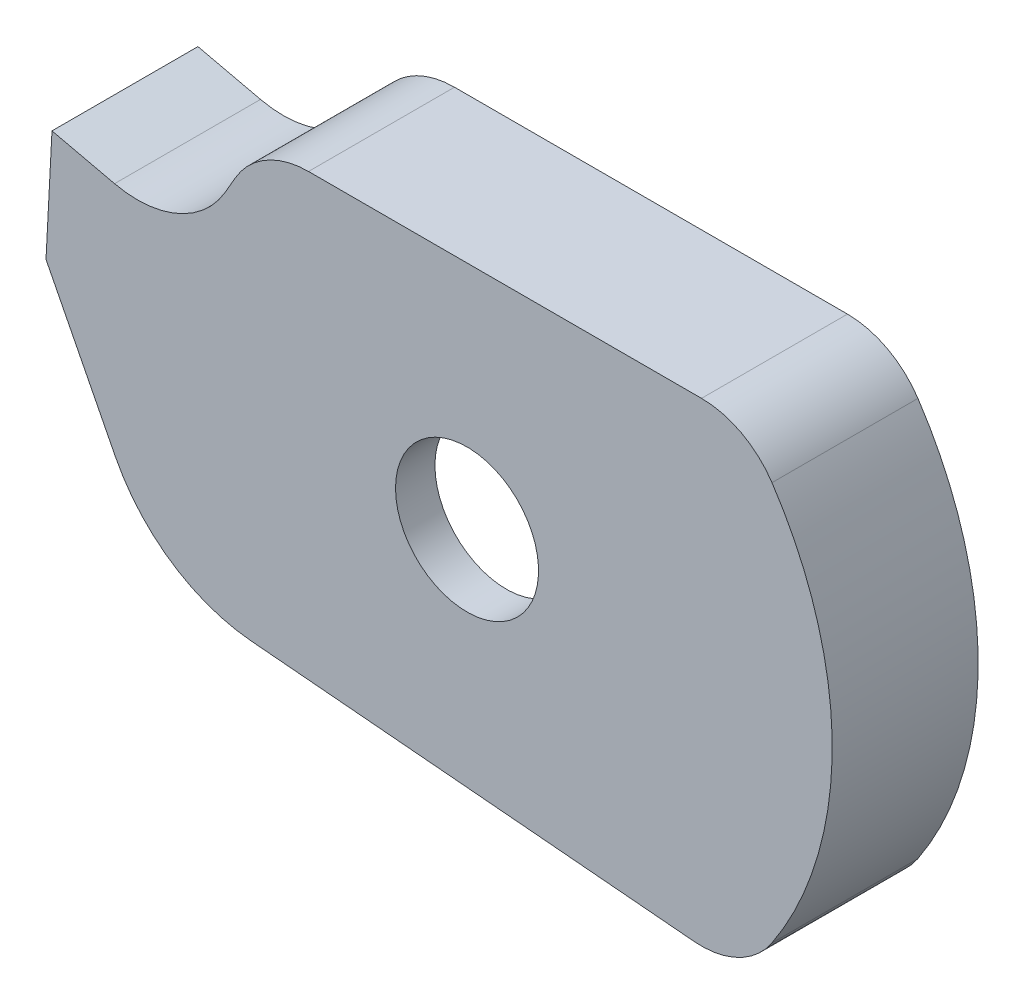
from build123d import *

# Parameters (mm, degrees)
EXTRUS_O_ESQ_DEPTH   = 50
REBAIXO_CAMISA_DEPTH = 36.5
ESBO_O2_3_R          = 24.5
FURO_EIXO_DEPTH      = 175.517212369
FILETE1_R            = 7


with BuildPart() as part:
    # Sketch2 → EXTRUSÃO ESQ (new body)
    with BuildSketch(Plane.XY):
        with BuildLine():
            Line((-122.610977602, 44.351076804), (-144.047119027, 49.3))
            Line((-144.047119027, 49.3), (-146.098883586, 10.15))
            Line((-146.098883586, 10.15), (-122.334497064, -36.490234645))
            ThreePointArc((-122.334497064, -36.490234645), (-103.089307062, -58.242964868), (-75.71115174, -67.938078149))
            Line((-75.71115174, -67.938078149), (75.873308647, -81.2))
            ThreePointArc((75.873308647, -81.2), (90.951418202, -78.45385419), (102.524156014, -68.405847219))
            ThreePointArc((102.524156014, -68.405847219), (123.249969505, -0.086700127), (102.620294615, 68.261538462))
            ThreePointArc((102.620294615, 68.261538462), (92.171338681, 77.761539619), (78.474342941, 81.2))
            Line((78.474342941, 81.2), (-56.15804675, 81.2))
            ThreePointArc((-56.15804675, 81.2), (-70.65804675, 77.31473671), (-81.27278346, 66.7))
            Line((-81.27278346, 66.7), (-84.644996859, 60.859155059))
            ThreePointArc((-84.644996859, 60.859155059), (-100.906213312, 46.34546447), (-122.610977602, 44.351076804))
        make_face()
    extrude(amount=EXTRUS_O_ESQ_DEPTH)

    # Esboço2 → REBAIXO CAMISA (cut)
    with BuildSketch(Plane(origin=(0, 0, 0), x_dir=(-1, 0, 0), z_dir=(0, 0, -1))):
        with BuildLine():
            Line((-47.203483412, 58.071858667), (40.46165002, 65.741564029))
            ThreePointArc((40.46165002, 65.741564029), (52.140743659, 62.059159949), (57.795257074, 51.196940743))
            Line((57.795257074, 51.196940743), (65.464962436, -36.468192689))
            ThreePointArc((65.464962436, -36.468192689), (61.782558356, -48.147286328), (50.92033915, -53.801799742))
            Line((50.92033915, -53.801799742), (-36.744794282, -61.471505104))
            ThreePointArc((-36.744794282, -61.471505104), (-48.423887921, -57.789101024), (-54.078401335, -46.926881818))
            Line((-54.078401335, -46.926881818), (-61.748106697, 40.738251614))
            ThreePointArc((-61.748106697, 40.738251614), (-58.065702618, 52.417345253), (-47.203483412, 58.071858667))
        make_face()
    extrude(amount=-REBAIXO_CAMISA_DEPTH, mode=Mode.SUBTRACT)

    # Esboço2<3> → FURO EIXO (cut, through all)
    with BuildSketch(Plane(origin=(0, 0, 0), x_dir=(-1, 0, 0), z_dir=(0, 0, -1))):
        with Locations((1.858427869, 2.135029462)):
            Circle(ESBO_O2_3_R)
    extrude(amount=-FURO_EIXO_DEPTH, mode=Mode.SUBTRACT)

    # Filete1
    filete1_edges = [part.edges().sort_by_distance(p)[0] for p in [
        (58.065702618, 52.417345253, 0),
        (57.913254016, -3.094315102, 0),
        (48.423887921, -57.789101024, 0),
        (-7.087772434, -57.636652423, 0),
        (-61.782558356, -48.147286328, 0),
        (-61.630109755, 7.364374027, 0),
        (-52.140743659, 62.059159949, 0),
        (3.370916696, 61.906711348, 0),
    ]]
    fillet(filete1_edges, radius=FILETE1_R)


solid = part.part
